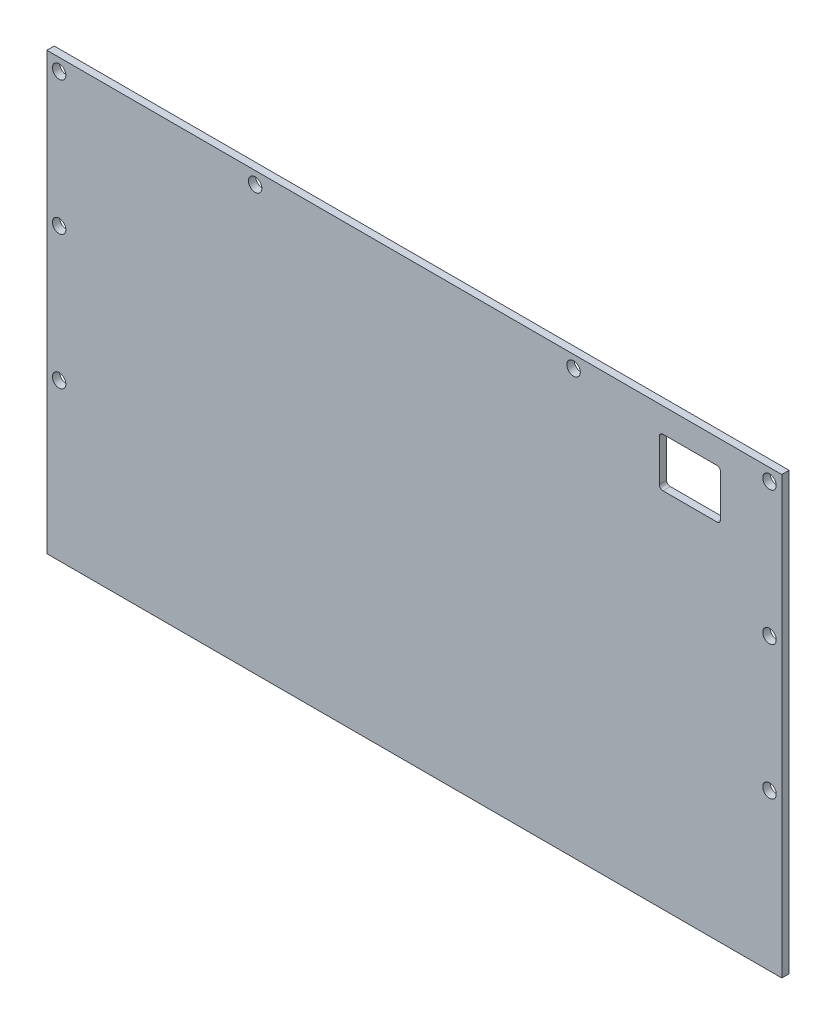
from build123d import *

# Parameters (mm, degrees)
SKETCH1_W                    = 300
SKETCH1_H                    = 178
BOSS_EXTRUDE1_DEPTH          = 3
M5_CLEARANCE_HOLE1_OUTLINE_R = 2.75
M5_CLEARANCE_HOLE1_DEPTH     = 3
SKETCH4_W                    = 25
SKETCH4_H                    = 20
CUT_EXTRUDE1_DEPTH           = 10
FILLET1_R                    = 1.5


# Read off the part's stored shape, not the designer's step: M5 Clearance Hole1
with BuildPart() as part:
    # Sketch1 → Boss-Extrude1 (new body)
    with BuildSketch(Plane.XY):
        with Locations((150, 89)):
            Rectangle(SKETCH1_W, SKETCH1_H)
    extrude(amount=BOSS_EXTRUDE1_DEPTH)

    # M5 Clearance Hole1 outline → M5 Clearance Hole1 (cut)
    with BuildSketch(Plane.XY):
        with Locations((295, 118.385)):
            Circle(M5_CLEARANCE_HOLE1_OUTLINE_R)
        with Locations((5, 118.385)):
            Circle(M5_CLEARANCE_HOLE1_OUTLINE_R)
        with Locations((295, 173)):
            Circle(M5_CLEARANCE_HOLE1_OUTLINE_R)
        with Locations((295, 63.77)):
            Circle(M5_CLEARANCE_HOLE1_OUTLINE_R)
        with Locations((5, 63.77)):
            Circle(M5_CLEARANCE_HOLE1_OUTLINE_R)
        with Locations((5, 173)):
            Circle(M5_CLEARANCE_HOLE1_OUTLINE_R)
        with Locations((85, 173)):
            Circle(M5_CLEARANCE_HOLE1_OUTLINE_R)
        with Locations((215, 173)):
            Circle(M5_CLEARANCE_HOLE1_OUTLINE_R)
    extrude(amount=M5_CLEARANCE_HOLE1_DEPTH, mode=Mode.SUBTRACT)

    # Sketch4 → Cut-Extrude1 (cut)
    with BuildSketch(Plane.XY.offset(3)):
        with Locations((262.5, 158)):
            Rectangle(SKETCH4_W, SKETCH4_H)
    extrude(amount=-CUT_EXTRUDE1_DEPTH, mode=Mode.SUBTRACT)

    # Fillet1
    fillet1_edges = [part.edges().sort_by_distance(p)[0] for p in [
        (250, 148, 1.5),
        (250, 168, 1.5),
        (275, 168, 1.5),
        (275, 148, 1.5),
    ]]
    fillet(fillet1_edges, radius=FILLET1_R)


solid = part.part
